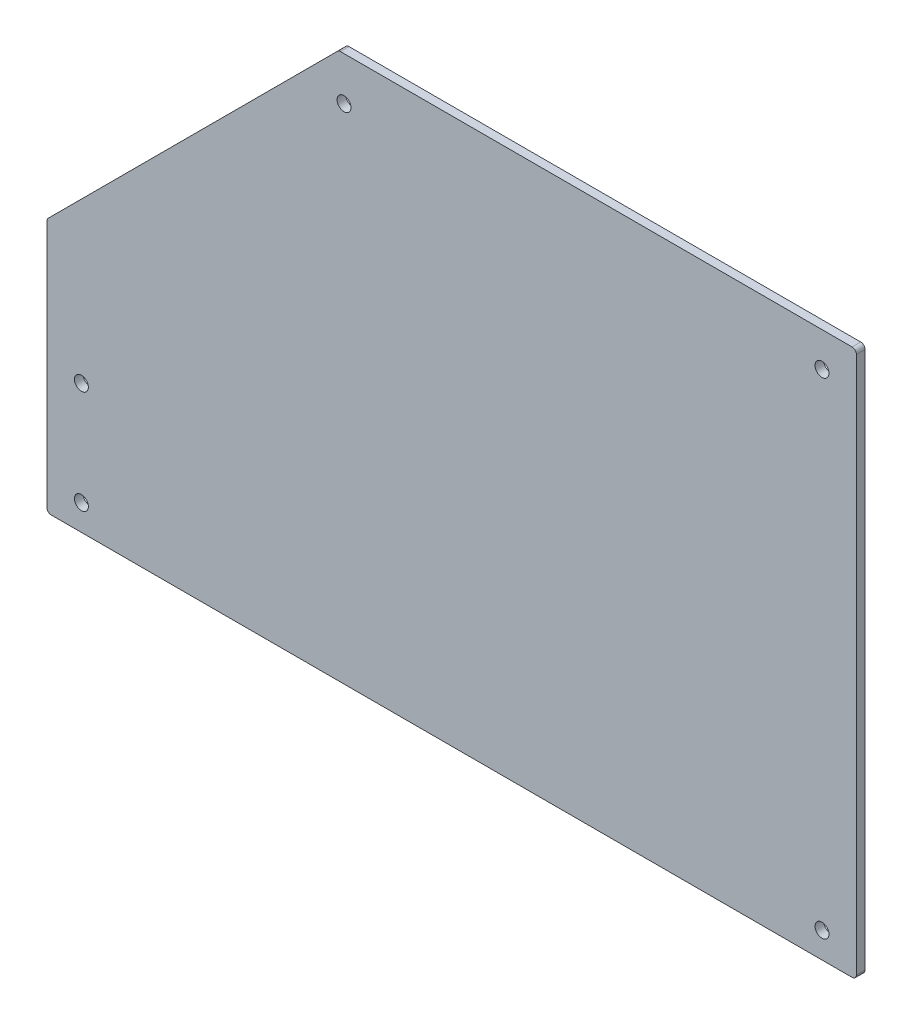
from build123d import *

# Parameters (mm, degrees)
SKETCH2_W           = 470
SKETCH2_H           = 317
BOSS_EXTRUDE1_DEPTH = 2.5
SKETCH3_R           = 4.05
CUT_EXTRUDE1_DEPTH  = 10
FILLET2_R           = 2.5
CUT_EXTRUDE14_DEPTH = 284.5
FILLET3_R           = 2.5


with BuildPart() as part:
    # Sketch2 → Boss-Extrude1 (new, symmetric)
    with BuildSketch(Plane.XY):
        Rectangle(SKETCH2_W, SKETCH2_H)
    extrude(amount=BOSS_EXTRUDE1_DEPTH, both=True)

    # Sketch3 → Cut-Extrude1 (cut)
    with BuildSketch(Plane.XY.offset(2.5)):
        with Locations((-215, -83.5)):
            Circle(SKETCH3_R)
        with Locations((-215, -143.5)):
            Circle(SKETCH3_R)
        with Locations((215, -143.5)):
            Circle(SKETCH3_R)
        with Locations((-62.5, 133.34)):
            Circle(SKETCH3_R)
        with Locations((215, 138.5)):
            Circle(SKETCH3_R)
    extrude(amount=-CUT_EXTRUDE1_DEPTH, mode=Mode.SUBTRACT)

    # Fillet2
    fillet2_edges = [part.edges().sort_by_distance(p)[0] for p in [
        (-235, -158.5, 0),
        (235, -158.5, 0),
        (235, 158.5, 0),
        (-235, 158.5, 0),
    ]]
    fillet(fillet2_edges, radius=FILLET2_R)

    # Sketch26 → Cut-Extrude14 (cut, through all)
    with BuildSketch(Plane.XY.offset(2.5)):
        Polygon((-32.351626406, 191.772644842), (-286.046542749, -61.922271502), (-286.046542749, 282.491923936), align=None)
    extrude(amount=-CUT_EXTRUDE14_DEPTH, mode=Mode.SUBTRACT)

    # Fillet3
    fillet3_edges = [part.edges().sort_by_distance(p)[0] for p in [
        (-235, -10.875728753, 0),
        (-65.624271247, 158.5, 0),
    ]]
    fillet(fillet3_edges, radius=FILLET3_R)


solid = part.part
